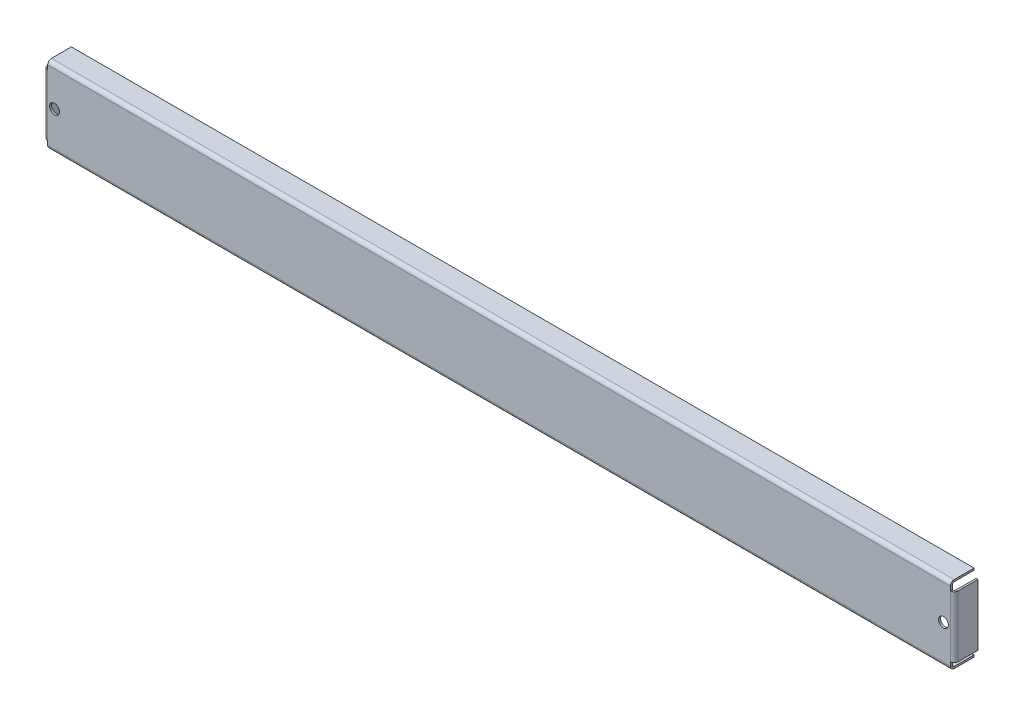
from build123d import *

# Parameters (mm, degrees)
CROQUIS1_W                   = 731.774
CROQUIS1_H                   = 61.976
BRIDA_BASE1_DEPTH            = 1.524
CROQUIS6_W                   = 3.1242
CROQUIS6_H                   = 6.35
CORTAR_EXTRUIR1_DEPTH        = 368.200048324
BRIDA_START                  = -362.7628
BRIDA_DE_ARISTA1_DEPTH       = 725.5256
BRIDA_START_2                = 6.35
BRIDA_DE_ARISTA1_2_DEPTH     = 49.276
BRIDA_DE_ARISTA1_3_DEPTH     = 725.5256
BRIDA_DE_ARISTA1_4_OUTLINE_W = 0.1524
BRIDA_DE_ARISTA1_4_OUTLINE_H = 1.524
BRIDA_DE_ARISTA1_4_DEPTH     = 0.0762
BRIDA_START_3                = 362.6866
BRIDA_DE_ARISTA1_5_OUTLINE_W = 0.1524
BRIDA_DE_ARISTA1_5_OUTLINE_H = 1.524
BRIDA_DE_ARISTA1_5_DEPTH     = 0.0762
BRIDA_DE_ARISTA1_6_DEPTH     = 49.276
CROQUIS19_R                  = 3.9624
CORTAR_EXTRUIR2_DEPTH        = 368.690706183


# Read off the part's stored shape, not the designer's step: Brida de arista1
# Sheet-metal steps are written as plain solids
with BuildPart() as part:
    # Croquis1 → Brida base1 (new body)
    with BuildSketch(Plane.XY):
        Rectangle(CROQUIS1_W, CROQUIS1_H)
    extrude(amount=-BRIDA_BASE1_DEPTH)

    # Croquis6 → Cortar-Extruir1 (cut, through all)
    with BuildSketch(Plane.XY):
        with Locations((364.3249, 27.813)):
            Rectangle(CROQUIS6_W, CROQUIS6_H)
        with Locations((364.3249, -27.813)):
            Rectangle(CROQUIS6_W, CROQUIS6_H)
        with Locations((-364.3249, -27.813)):
            Rectangle(CROQUIS6_W, CROQUIS6_H)
        with Locations((-364.3249, 27.813)):
            Rectangle(CROQUIS6_W, CROQUIS6_H)
    extrude(amount=-CORTAR_EXTRUIR1_DEPTH, mode=Mode.SUBTRACT)

    # Brida de arista1 outline → Brida de arista1 (add)
    with BuildSketch(Plane.YZ.offset(BRIDA_START)):
        with BuildLine():
            Line((30.988, -19.05), (30.988, -3.048))
            ThreePointArc((30.988, -3.048), (30.884141918, -2.259119551), (30.579645431, -1.524))
            Line((30.579645431, -1.524), (27.94, -1.524))
            ThreePointArc((27.94, -1.524), (29.017630735, -1.970369265), (29.464, -3.048))
            Line((29.464, -3.048), (29.464, -19.05))
            Line((29.464, -19.05), (30.988, -19.05))
        make_face()
        with BuildLine():
            ThreePointArc((-29.464, -3.048), (-29.017630735, -1.970369265), (-27.94, -1.524))
            Line((-27.94, -1.524), (-30.579645431, -1.524))
            ThreePointArc((-30.579645431, -1.524), (-30.884141918, -2.259119551), (-30.988, -3.048))
            Line((-30.988, -3.048), (-30.988, -19.05))
            Line((-30.988, -19.05), (-29.464, -19.05))
            Line((-29.464, -19.05), (-29.464, -3.048))
        make_face()
    extrude(amount=BRIDA_DE_ARISTA1_DEPTH)

    # Brida de arista1 2 outline → Brida de arista1 2 (add)
    with BuildSketch(Plane(origin=(0, 30.988, -1.524), x_dir=(-1, 0, 0), z_dir=(0, -1, 0)).offset(BRIDA_START_2)):
        with BuildLine():
            Line((-364.363, 1.524), (-364.363, 17.526))
            Line((-364.363, 17.526), (-365.887, 17.526))
            Line((-365.887, 17.526), (-365.887, 1.524))
            ThreePointArc((-365.887, 1.524), (-365.783141918, 0.735119551), (-365.478645431, 0))
            Line((-365.478645431, 0), (-362.839, 0))
            ThreePointArc((-362.839, 0), (-363.916630735, 0.446369265), (-364.363, 1.524))
        make_face()
        with BuildLine():
            ThreePointArc((364.363, 1.524), (363.916630735, 0.446369265), (362.839, 0))
            Line((362.839, 0), (365.478645431, 0))
            ThreePointArc((365.478645431, 0), (365.783141918, 0.735119551), (365.887, 1.524))
            Line((365.887, 1.524), (365.887, 17.526))
            Line((365.887, 17.526), (364.363, 17.526))
            Line((364.363, 17.526), (364.363, 1.524))
        make_face()
    extrude(amount=BRIDA_DE_ARISTA1_2_DEPTH)

    # Brida de arista1 3 outline → Brida de arista1 3 (cut)
    with BuildSketch(Plane.YZ.offset(BRIDA_START)):
        with BuildLine():
            ThreePointArc((27.94, 0), (29.464, -0.408354569), (30.579645431, -1.524))
            Line((30.579645431, -1.524), (30.988, -1.524))
            Line((30.988, -1.524), (30.988, 0))
            Line((30.988, 0), (27.94, 0))
        make_face()
        with BuildLine():
            ThreePointArc((-30.579645431, -1.524), (-29.464, -0.408354569), (-27.94, 0))
            Line((-27.94, 0), (-30.988, 0))
            Line((-30.988, 0), (-30.988, -1.524))
            Line((-30.988, -1.524), (-30.579645431, -1.524))
        make_face()
    extrude(amount=BRIDA_DE_ARISTA1_3_DEPTH, mode=Mode.SUBTRACT)

    # Brida de arista1 4 outline → Brida de arista1 4 (cut)
    with BuildSketch(Plane.YZ.offset(BRIDA_START)):
        with Locations((24.7142, -0.762)):
            Rectangle(BRIDA_DE_ARISTA1_4_OUTLINE_W, BRIDA_DE_ARISTA1_4_OUTLINE_H)
        with Locations((-24.7142, -0.762)):
            Rectangle(BRIDA_DE_ARISTA1_4_OUTLINE_W, BRIDA_DE_ARISTA1_4_OUTLINE_H)
    extrude(amount=BRIDA_DE_ARISTA1_4_DEPTH, mode=Mode.SUBTRACT)

    # Brida de arista1 5 outline → Brida de arista1 5 (cut)
    with BuildSketch(Plane.YZ.offset(BRIDA_START_3)):
        with Locations((24.7142, -0.762)):
            Rectangle(BRIDA_DE_ARISTA1_5_OUTLINE_W, BRIDA_DE_ARISTA1_5_OUTLINE_H)
        with Locations((-24.7142, -0.762)):
            Rectangle(BRIDA_DE_ARISTA1_5_OUTLINE_W, BRIDA_DE_ARISTA1_5_OUTLINE_H)
    extrude(amount=BRIDA_DE_ARISTA1_5_DEPTH, mode=Mode.SUBTRACT)

    # Brida de arista1 6 outline → Brida de arista1 6 (cut)
    with BuildSketch(Plane(origin=(0, 30.988, -1.524), x_dir=(-1, 0, 0), z_dir=(0, -1, 0)).offset(BRIDA_START_2)):
        with BuildLine():
            ThreePointArc((-362.839, -1.524), (-364.363, -1.115645431), (-365.478645431, 0))
            Line((-365.478645431, 0), (-365.887, 0))
            Line((-365.887, 0), (-365.887, -1.524))
            Line((-365.887, -1.524), (-362.839, -1.524))
        make_face()
        with BuildLine():
            Line((365.887, 0), (365.478645431, 0))
            ThreePointArc((365.478645431, 0), (364.363, -1.115645431), (362.839, -1.524))
            Line((362.839, -1.524), (365.887, -1.524))
            Line((365.887, -1.524), (365.887, 0))
        make_face()
    extrude(amount=BRIDA_DE_ARISTA1_6_DEPTH, mode=Mode.SUBTRACT)

    # Croquis19 → Cortar-Extruir2 (cut, through all)
    with BuildSketch(Plane.XY):
        with Locations((-357.251, 0)):
            Circle(CROQUIS19_R)
        with Locations((357.251, 0)):
            Circle(CROQUIS19_R)
    extrude(amount=-CORTAR_EXTRUIR2_DEPTH, mode=Mode.SUBTRACT)


solid = part.part
